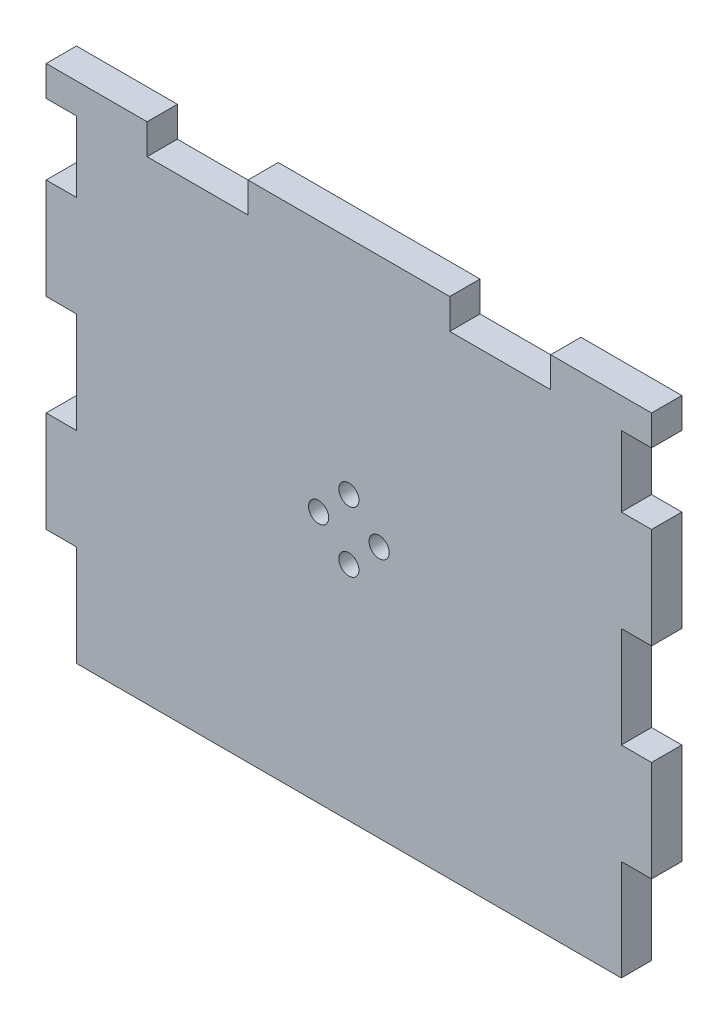
from build123d import *

# Parameters (mm, degrees)
SKETCH1_W           = 60
SKETCH1_H           = 50
BOSS_EXTRUDE1_DEPTH = 3
SKETCH2_W           = 10
SKETCH2_H           = 3
CUT_EXTRUDE1_DEPTH  = 3
SKETCH3_R           = 1
CUT_EXTRUDE2_DEPTH  = 10
CAVITY3_START       = -25
CAVITY3_OUTLINE_W   = 3
CAVITY3_OUTLINE_H   = 3
CAVITY3_DEPTH       = 10
CAVITY3_START_2     = -5
CAVITY3_2_OUTLINE_W = 3
CAVITY3_2_OUTLINE_H = 3
CAVITY3_2_DEPTH     = 10
CAVITY3_START_3     = 15
CAVITY3_3_OUTLINE_W = 3
CAVITY3_3_OUTLINE_H = 3
CAVITY3_3_DEPTH     = 7


# Read off the part's stored shape, not the designer's step: Cavity3
with BuildPart() as part:
    # Sketch1 → Boss-Extrude1 (new body)
    with BuildSketch(Plane.XY):
        Rectangle(SKETCH1_W, SKETCH1_H)
    extrude(amount=BOSS_EXTRUDE1_DEPTH)

    # Sketch2 → Cut-Extrude1 (cut)
    with BuildSketch(Plane.XY.offset(3)):
        with Locations((-15, 23.5)):
            Rectangle(SKETCH2_W, SKETCH2_H)
        with Locations((15, 23.5)):
            Rectangle(SKETCH2_W, SKETCH2_H)
    extrude(amount=-CUT_EXTRUDE1_DEPTH, mode=Mode.SUBTRACT)

    # Sketch3 → Cut-Extrude2 (cut)
    with BuildSketch(Plane.XY.offset(3)):
        with Locations((0, 3)):
            Circle(SKETCH3_R)
        with Locations((3, 0)):
            Circle(SKETCH3_R)
        with Locations((0, -3)):
            Circle(SKETCH3_R)
        with Locations((-3, 0)):
            Circle(SKETCH3_R)
    extrude(amount=-CUT_EXTRUDE2_DEPTH, mode=Mode.SUBTRACT)

    # Cavity3 outline → Cavity3 (cut)
    with BuildSketch(Plane(origin=(0, 0, 0), x_dir=(1, 0, 0), z_dir=(0, 1, 0)).offset(CAVITY3_START)):
        with Locations((28.5, -1.5)):
            Rectangle(CAVITY3_OUTLINE_W, CAVITY3_OUTLINE_H)
        with Locations((-28.5, -1.5)):
            Rectangle(CAVITY3_OUTLINE_W, CAVITY3_OUTLINE_H)
    extrude(amount=CAVITY3_DEPTH, mode=Mode.SUBTRACT)

    # Cavity3 2 outline → Cavity3 2 (cut)
    with BuildSketch(Plane(origin=(0, 0, 0), x_dir=(1, 0, 0), z_dir=(0, 1, 0)).offset(CAVITY3_START_2)):
        with Locations((28.5, -1.5)):
            Rectangle(CAVITY3_2_OUTLINE_W, CAVITY3_2_OUTLINE_H)
        with Locations((-28.5, -1.5)):
            Rectangle(CAVITY3_2_OUTLINE_W, CAVITY3_2_OUTLINE_H)
    extrude(amount=CAVITY3_2_DEPTH, mode=Mode.SUBTRACT)

    # Cavity3 3 outline → Cavity3 3 (cut)
    with BuildSketch(Plane(origin=(0, 0, 0), x_dir=(1, 0, 0), z_dir=(0, 1, 0)).offset(CAVITY3_START_3)):
        with Locations((28.5, -1.5)):
            Rectangle(CAVITY3_3_OUTLINE_W, CAVITY3_3_OUTLINE_H)
        with Locations((-28.5, -1.5)):
            Rectangle(CAVITY3_3_OUTLINE_W, CAVITY3_3_OUTLINE_H)
    extrude(amount=CAVITY3_3_DEPTH, mode=Mode.SUBTRACT)


solid = part.part
